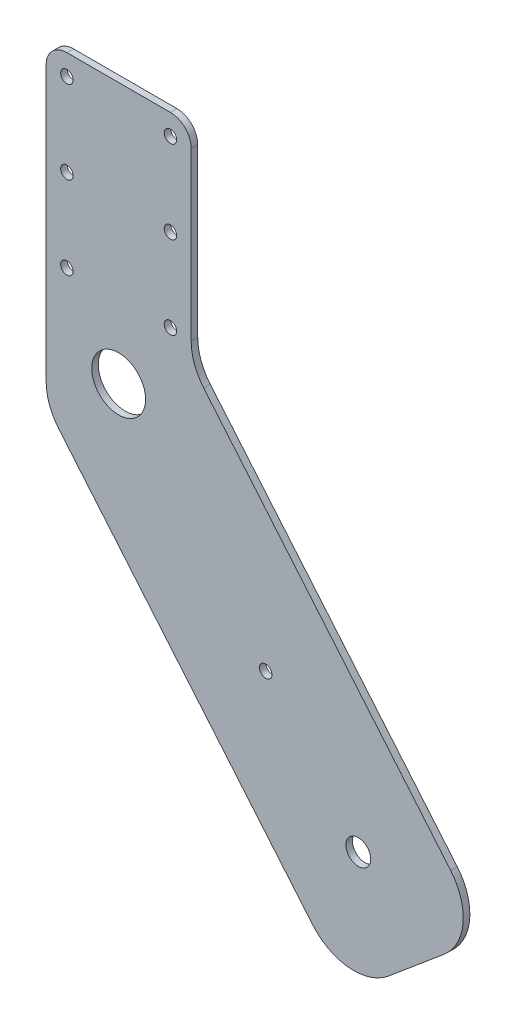
from build123d import *

# Parameters (mm, degrees)
SKETCH1_R           = 6.5
SKETCH1_R_2         = 1.5
SKETCH1_R_3         = 3
BOSS_EXTRUDE1_DEPTH = 1.5875
FILLET1_R           = 5
FILLET2_R           = 13


with BuildPart() as part:
    # Sketch1 → Boss-Extrude1 (new body)
    with BuildSketch(Plane.XY):
        Polygon((0, 0), (0, 50), (35, 50), (35, 0), (106.009911505, -84.626317146), (72.668567607, -112.603026514), (0, -26), align=None)
        with Locations((17.5, -13)):
            Circle(SKETCH1_R, mode=Mode.SUBTRACT)
        with Locations((5, 45)):
            Circle(SKETCH1_R_2, mode=Mode.SUBTRACT)
        with Locations((5, 25)):
            Circle(SKETCH1_R_2, mode=Mode.SUBTRACT)
        with Locations((5, 5)):
            Circle(SKETCH1_R_2, mode=Mode.SUBTRACT)
        with Locations((30, 5)):
            Circle(SKETCH1_R_2, mode=Mode.SUBTRACT)
        with Locations((30, 25)):
            Circle(SKETCH1_R_2, mode=Mode.SUBTRACT)
        with Locations((30, 45)):
            Circle(SKETCH1_R_2, mode=Mode.SUBTRACT)
        with Locations((75.350884872, -81.943999881)):
            Circle(SKETCH1_R_3, mode=Mode.SUBTRACT)
        with Locations((53.004955752, -55.313158573)):
            Circle(SKETCH1_R_2, mode=Mode.SUBTRACT)
    extrude(amount=BOSS_EXTRUDE1_DEPTH)

    # Fillet1
    fillet1_edges = [part.edges().sort_by_distance(p)[0] for p in [
        (0, 50, 0.79375),
        (35, 50, 0.79375),
    ]]
    fillet(fillet1_edges, radius=FILLET1_R)

    # Fillet2
    fillet2_edges = [part.edges().sort_by_distance(p)[0] for p in [
        (72.668567607, -112.603026514, 0.79375),
        (106.009911505, -84.626317146, 0.79375),
        (35, 0, 0.79375),
        (0, -26, 0.79375),
    ]]
    fillet(fillet2_edges, radius=FILLET2_R)


solid = part.part
